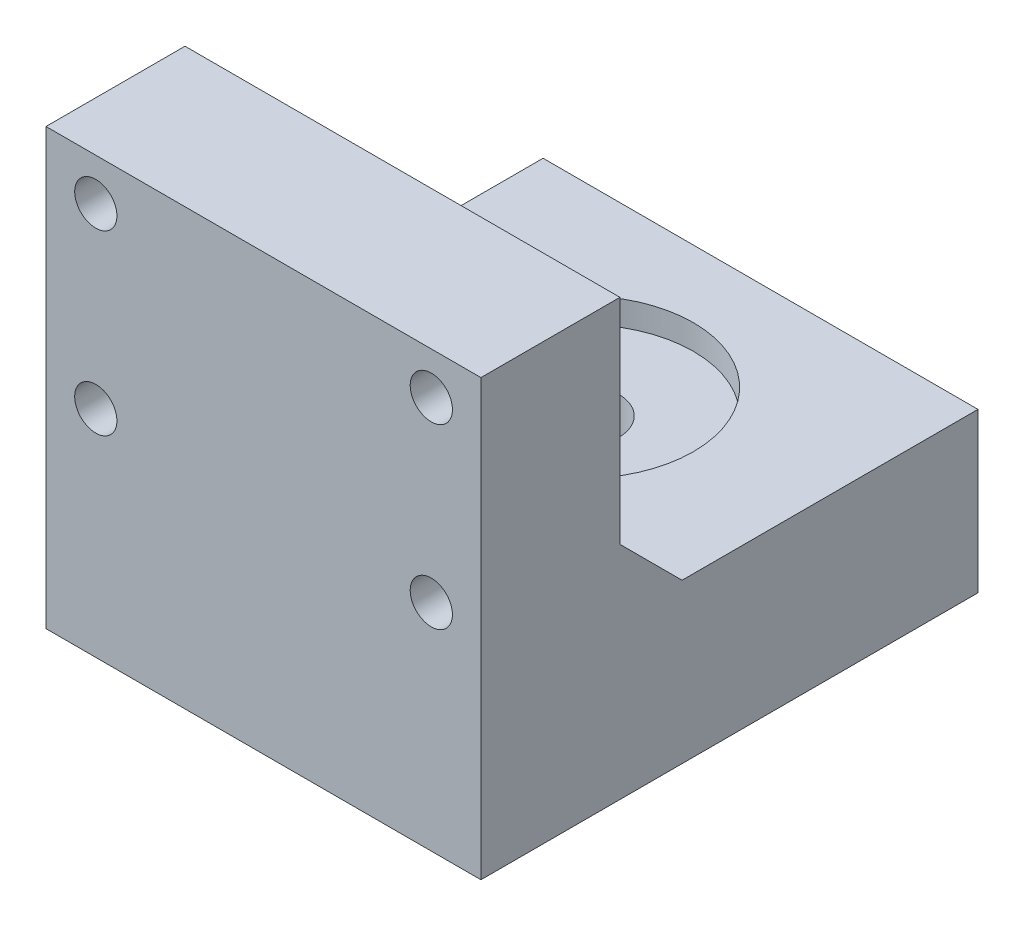
from build123d import *

# Parameters (mm, degrees)
BOSS_EXTRUDE1_DEPTH = 35
SKETCH3_R           = 3.0015
CUT_EXTRUDE1_DEPTH  = 58.606470928
SKETCH3_5_R         = 9
CUT_EXTRUDE2_DEPTH  = 2
SKETCH4_R           = 1.7
CUT_EXTRUDE3_DEPTH  = 58.272989631
CHAMFER1_SIZE       = 5


with BuildPart() as part:
    # Sketch1 → Boss-Extrude1 (new body)
    with BuildSketch(Plane(origin=(0, 0, 0), x_dir=(0, 0, -1), z_dir=(1, 0, 0))):
        Polygon((0, 35), (0, 0), (40, 0), (40, 12.785016481), (11.186889421, 12.785016481), (11.186889421, 35), align=None)
    extrude(amount=BOSS_EXTRUDE1_DEPTH)

    # Sketch3 → Cut-Extrude1 (cut, through all)
    with BuildSketch(Plane(origin=(0, 12.785016481, 0), x_dir=(1, 0, 0), z_dir=(0, 1, 0))):
        with Locations(Location((17.5, 25.59344471, 0), (0, 0, 270))):
            Circle(SKETCH3_R)
    extrude(amount=-CUT_EXTRUDE1_DEPTH, mode=Mode.SUBTRACT)

    # Sketch3<5> → Cut-Extrude2 (cut)
    with BuildSketch(Plane(origin=(0, 12.785016481, 0), x_dir=(1, 0, 0), z_dir=(0, 1, 0))):
        with Locations(Location((17.5, 25.59344471, 0), (0, 0, 270))):
            Circle(SKETCH3_5_R)
    extrude(amount=-CUT_EXTRUDE2_DEPTH, mode=Mode.SUBTRACT)

    # Sketch4 → Cut-Extrude3 (cut, through all)
    with BuildSketch(Plane(origin=(0, 0, -11.186889421), x_dir=(-1, 0, 0), z_dir=(0, 0, -1))):
        with Locations((-31.00681869, 31.616501478)):
            Circle(SKETCH4_R)
        with Locations((-31.00681869, 17.332786674)):
            Circle(SKETCH4_R)
        with Locations((-4.00681869, 17.332786674)):
            Circle(SKETCH4_R)
        with Locations((-4.00681869, 31.616501478)):
            Circle(SKETCH4_R)
    extrude(amount=-CUT_EXTRUDE3_DEPTH, mode=Mode.SUBTRACT)

    # Chamfer1
    # the kernel refuses this chamfer: 5 mm, written as the material it adds along each edge
    with BuildSketch(Plane(origin=(0, 12.785016481, -11.186889421), x_dir=(0, 0.9996219169112968, 0.02749587661058631), z_dir=(1, 0, 0))) as chamfer1_piece_1_section:
        Polygon((CHAMFER1_SIZE * 0.999621916911, -CHAMFER1_SIZE * 0.0274958766106), (-CHAMFER1_SIZE * 0.0274958766106, -CHAMFER1_SIZE * 0.999621916911), (0, 0), align=None)
    chamfer1_piece_1 = extrude(amount=35, mode=Mode.PRIVATE)
    chamfer1_piece_1 = chamfer1_piece_1 - Plane(origin=(31.00681869, 17.332786674, -12.868450171), x_dir=(-1, 0, 0), z_dir=(0, 0, -1)) * Cylinder(1.7, 90, mode=Mode.PRIVATE)
    chamfer1_piece_1 = chamfer1_piece_1 - Plane(origin=(4.00681869, 17.332786674, -12.868450171), x_dir=(-1, 0, 0), z_dir=(0, 0, -1)) * Cylinder(1.7, 90, mode=Mode.PRIVATE)
    add(chamfer1_piece_1)


solid = part.part
